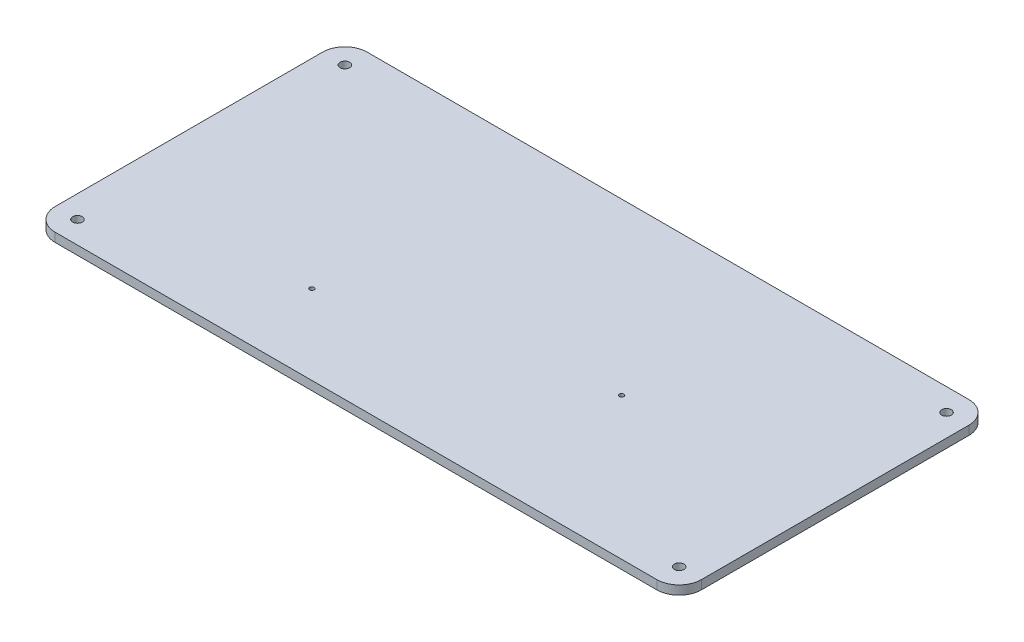
from build123d import *

# Parameters (mm, degrees)
SKETCH1_R               = 2.15
BOSS_EXTRUDE1_DEPTH     = 4
MIRROR2_COPY_1_SKETCH_R = 2.15
MIRROR2_COPY_1_DEPTH    = 4
MIRROR2_COPY_2_SKETCH_R = 2.15
MIRROR2_COPY_2_DEPTH    = 4
SKETCH2_R               = 1
CUT_EXTRUDE1_DEPTH      = 10


with BuildPart() as part:
    # Sketch1 → Boss-Extrude1 (new body)
    with BuildSketch(Plane(origin=(0, 0, 0), x_dir=(1, 0, 0), z_dir=(0, 1, 0))):
        with BuildLine():
            Line((145, -60), (145, 0))
            Line((145, 0), (0, 0))
            Line((0, 0), (0, -70))
            Line((0, -70), (135, -70))
            ThreePointArc((135, -70), (142.071067812, -67.071067812), (145, -60))
        make_face()
        with Locations((135, -60)):
            Circle(SKETCH1_R, mode=Mode.SUBTRACT)
    boss_extrude1 = extrude(amount=BOSS_EXTRUDE1_DEPTH)

    # Mirror1: Boss-Extrude1 across plane
    add(boss_extrude1.mirror(Plane(origin=(0, 0, 0), x_dir=(0, 0, 1), z_dir=(1, 0, 0))))

    # Mirror2 copy 1 sketch → Mirror2 copy 1 (add)
    with BuildSketch(Plane(origin=(0, 0, 0), x_dir=(-1, 0, 0), z_dir=(0, 1, 0))):
        with BuildLine():
            Line((145, -60), (145, 0))
            Line((145, 0), (0, 0))
            Line((0, 0), (0, -70))
            Line((0, -70), (135, -70))
            ThreePointArc((135, -70), (142.071067812, -67.071067812), (145, -60))
        make_face()
        with Locations((135, -60)):
            Circle(MIRROR2_COPY_1_SKETCH_R, mode=Mode.SUBTRACT)
    extrude(amount=MIRROR2_COPY_1_DEPTH)

    # Mirror2 copy 2 sketch → Mirror2 copy 2 (add)
    with BuildSketch(Plane(origin=(0, 0, 0), x_dir=(1, 0, 0), z_dir=(0, 1, 0))):
        with BuildLine():
            Line((145, 60), (145, 0))
            Line((145, 0), (0, 0))
            Line((0, 0), (0, 70))
            Line((0, 70), (135, 70))
            ThreePointArc((135, 70), (142.071067812, 67.071067812), (145, 60))
        make_face()
        with Locations((135, 60)):
            Circle(MIRROR2_COPY_2_SKETCH_R, mode=Mode.SUBTRACT)
    extrude(amount=MIRROR2_COPY_2_DEPTH)

    # Sketch2 → Cut-Extrude1 (cut)
    with BuildSketch(Plane(origin=(0, 6, 0), x_dir=(1, 0, 0), z_dir=(0, 1, 0))):
        with Locations((55.5, -6.309138883)):
            Circle(SKETCH2_R)
        with Locations((-55.5, -34.309138883)):
            Circle(SKETCH2_R)
    extrude(amount=-CUT_EXTRUDE1_DEPTH, mode=Mode.SUBTRACT)


solid = part.part
